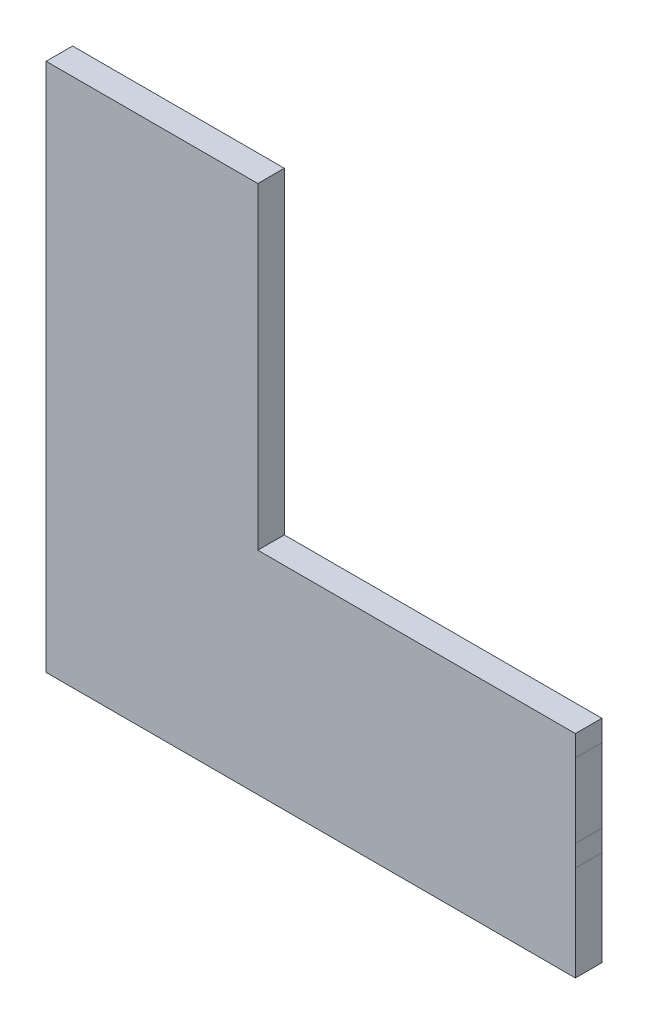
from build123d import *

# Parameters (mm, degrees)
BOSS_EXTRUDE1_DEPTH = 50


with BuildPart() as part:
    # Sketch1 → Boss-Extrude1 (new body)
    with BuildSketch(Plane.XY):
        Polygon((0, 0), (1000, 0), (1000, 400), (400, 400), (400, 1000), (0, 1000), align=None)
    extrude(amount=BOSS_EXTRUDE1_DEPTH)


solid = part.part
